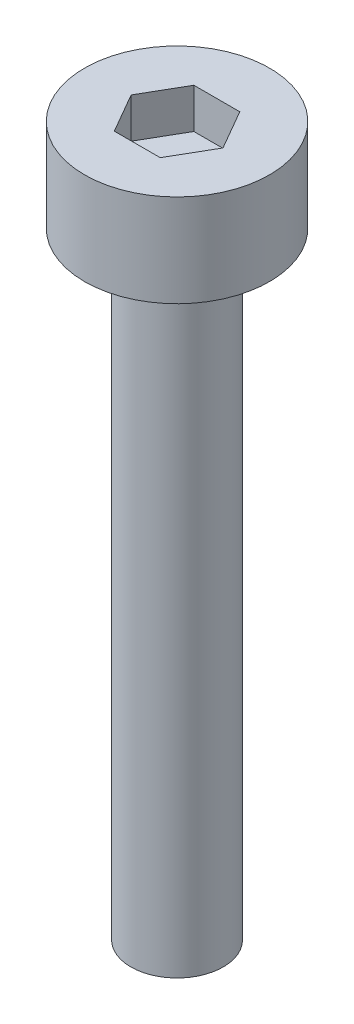
from build123d import *

# Parameters (mm, degrees)
SKETCH1_R           = 1.5
SCREWSHAFT_DEPTH    = 20
SKETCH2_R           = 3
BOSS_EXTRUDE2_DEPTH = 3
CUT_EXTRUDE1_DEPTH  = 1.3


with BuildPart() as part:
    # Sketch1 → ScrewShaft (new body)
    with BuildSketch(Plane(origin=(0, 0, 0), x_dir=(1, 0, 0), z_dir=(0, 1, 0))):
        Circle(SKETCH1_R)
    extrude(amount=SCREWSHAFT_DEPTH)

    # Sketch2 → Boss-Extrude2 (add)
    with BuildSketch(Plane(origin=(0, 20, 0), x_dir=(1, 0, 0), z_dir=(0, 1, 0))):
        Circle(SKETCH2_R)
    extrude(amount=BOSS_EXTRUDE2_DEPTH)

    # Sketch3 → Cut-Extrude1 (cut)
    with BuildSketch(Plane(origin=(0, 23, 0), x_dir=(1, 0, 0), z_dir=(0, 1, 0))):
        Polygon((1.489563695, 0), (0.744781847, 1.29), (-0.744781847, 1.29), (-1.489563695, 0), (-0.744781847, -1.29), (0.744781847, -1.29), align=None)
    extrude(amount=-CUT_EXTRUDE1_DEPTH, mode=Mode.SUBTRACT)


solid = part.part
